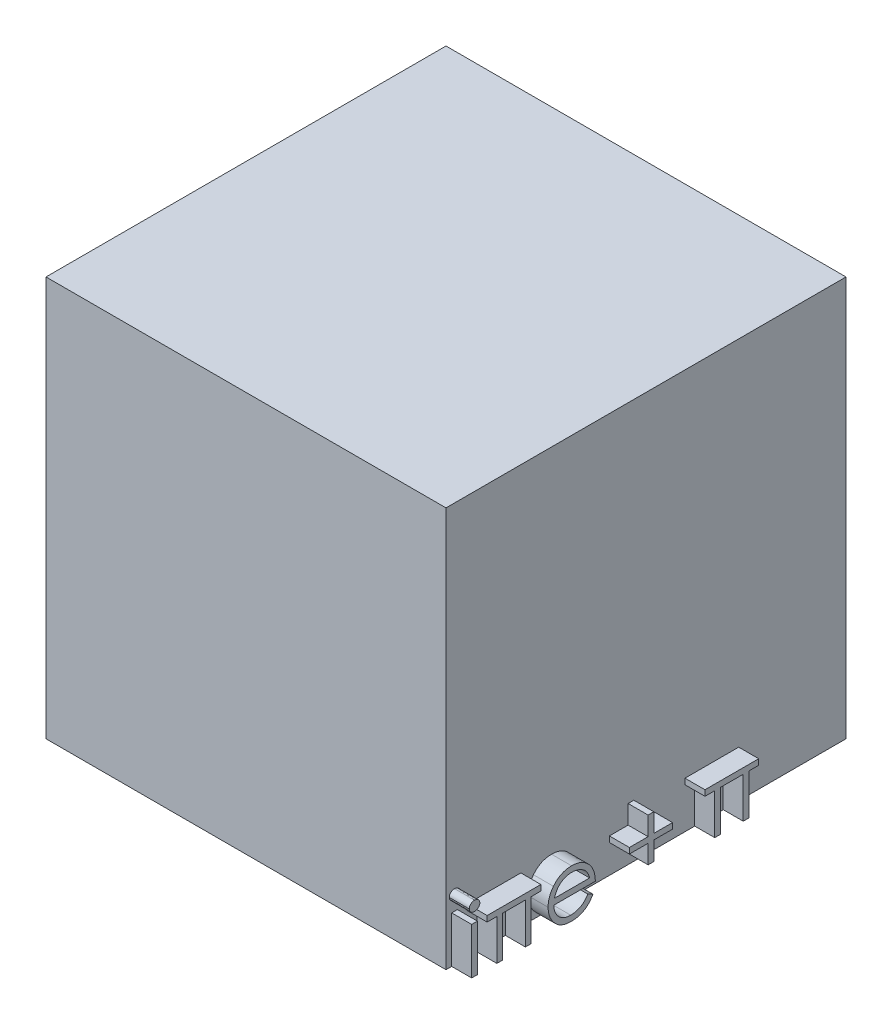
from build123d import *

# Parameters (mm, degrees)
SKETCH2_W           = 20
SKETCH2_H           = 20
BOSS_EXTRUDE1_DEPTH = 20
SKETCH3_W           = 0.284935898
SKETCH3_H           = 2.320192308
BOSS_EXTRUDE2_DEPTH = 1


with BuildPart() as part:
    # Sketch2 → Boss-Extrude1 (new body)
    with BuildSketch(Plane(origin=(0, 0, 0), x_dir=(1, 0, 0), z_dir=(0, 1, 0))):
        with Locations((10, -10)):
            Rectangle(SKETCH2_W, SKETCH2_H)
    extrude(amount=BOSS_EXTRUDE1_DEPTH)

    # Sketch3 → Boss-Extrude2 (add)
    # profile 1 of 6: a face of its own
    with BuildSketch(Plane(origin=(20, 0, 0), x_dir=(0, 0, -1), z_dir=(1, 0, 0))):
        with BuildLine():
            add(Edge.make_bspline(
                [(-19.573868189, 3.297115385), (-19.556186781, 3.296295189), (-19.521563189, 3.294689089), (-19.47149501, 3.280935463), (-19.425904721, 3.257622177), (-19.385466349, 3.226344181), (-19.350766423, 3.189560043), (-19.326472493, 3.146687593), (-19.310858391, 3.100370114), (-19.308972844, 3.06806214), (-19.308012821, 3.05161258)],
                knots=[0, 0, 0, 0, 1.055194115, 2.066272739, 3.074728998, 4.095836921, 5.109056067, 6.073838105, 7.019297344, 8, 8, 8, 8], degree=3))
            add(Edge.make_bspline(
                [(-19.308012821, 3.05161258), (-19.308994494, 3.03559003), (-19.310935147, 3.003915346), (-19.326460432, 2.958400839), (-19.350973462, 2.916124096), (-19.385444098, 2.879411381), (-19.425910617, 2.848150675), (-19.471493444, 2.824832805), (-19.521563601, 2.811080395), (-19.55618692, 2.809474127), (-19.573868189, 2.808653846)],
                knots=[0, 0, 0, 0, 0.96129708, 1.900370562, 2.859976407, 3.87933698, 4.906634145, 5.921202961, 6.938410037, 8, 8, 8, 8], degree=3))
            add(Edge.make_bspline(
                [(-19.573868189, 2.808653846), (-19.591347267, 2.809442807), (-19.625368009, 2.810978415), (-19.674686502, 2.825102646), (-19.71988806, 2.848158655), (-19.760405299, 2.879206694), (-19.794178403, 2.916349565), (-19.818760455, 2.958375039), (-19.834249885, 3.003921915), (-19.836195369, 3.035592237), (-19.837179487, 3.05161258)],
                knots=[0, 0, 0, 0, 1.054934014, 2.053291228, 3.073705704, 4.106921865, 5.123545215, 6.088680038, 7.033164197, 8, 8, 8, 8], degree=3))
            add(Edge.make_bspline(
                [(-19.837179487, 3.05161258), (-19.83621693, 3.068059851), (-19.834326407, 3.100363328), (-19.818748845, 3.146713822), (-19.794383162, 3.189332756), (-19.760382936, 3.226548745), (-19.719894012, 3.257614247), (-19.674684964, 3.280665637), (-19.625368416, 3.294791066), (-19.591347405, 3.296326509), (-19.573868189, 3.297115385)],
                knots=[0, 0, 0, 0, 0.98631895, 1.937192651, 2.907499808, 3.917963147, 4.944918757, 5.95915025, 6.951458133, 8, 8, 8, 8], degree=3))
        make_face()
    # profile 2 of 6: a face of its own
    with BuildSketch(Plane(origin=(20, 0, 0), x_dir=(0, 0, -1), z_dir=(1, 0, 0))):
        with Locations((-19.572596154, 1.160096154)):
            Rectangle(SKETCH3_W, SKETCH3_H)
    # profile 3 of 6: a face of its own
    with BuildSketch(Plane(origin=(20, 0, 0), x_dir=(0, 0, -1), z_dir=(1, 0, 0))):
        Polygon((-16.256585145, 2.03525641), (-16.745046683, 2.03525641), (-16.745046683, 0), (-17.029982581, 0), (-17.029982581, 2.03525641), (-18.169726171, 2.03525641), (-18.169726171, 0), (-18.454662068, 0), (-18.454662068, 2.03525641), (-18.943123606, 2.03525641), (-18.943123606, 2.320192308), (-16.256585145, 2.320192308), align=None)
    # profile 4 of 6: a face of its own
    with BuildSketch(Plane(origin=(20, 0, 0), x_dir=(0, 0, -1), z_dir=(1, 0, 0))):
        with BuildLine():
            Line((-13.909152811, 0.732692308), (-13.656017795, 0.599764623))
            add(Edge.make_bspline(
                [(-13.656017795, 0.599764623), (-13.676189563, 0.563983887), (-13.715435837, 0.494368744), (-13.782927944, 0.398726985), (-13.853677895, 0.312686557), (-13.930879352, 0.238546085), (-14.012222561, 0.1739109), (-14.098158612, 0.117361587), (-14.189134897, 0.069175501), (-14.285155718, 0.028578565), (-14.387027454, -0.002635762), (-14.494996972, -0.024683162), (-14.609271115, -0.038311413), (-14.687599435, -0.039894505), (-14.727707498, -0.040705128)],
                knots=[0, 0, 0, 0, 1.120438281, 2.179929193, 3.190490725, 4.156257408, 5.095198341, 6.022838206, 6.959905092, 7.901321166, 8.864066838, 9.862729781, 10.905609505, 12, 12, 12, 12], degree=3))
            add(Edge.make_bspline(
                [(-14.727707498, -0.040705128), (-14.772286292, -0.039664476), (-14.859246605, -0.037634466), (-14.985829089, -0.020133445), (-15.10500899, 0.008416481), (-15.216779607, 0.048299508), (-15.320867222, 0.100394295), (-15.417478712, 0.163857539), (-15.507122139, 0.238363227), (-15.586972671, 0.324556715), (-15.658858193, 0.416796776), (-15.722290902, 0.5129139), (-15.775320143, 0.612666254), (-15.818457153, 0.7154188), (-15.853295852, 0.820523904), (-15.877577076, 0.928937878), (-15.891574062, 1.040367301), (-15.893718952, 1.115748455), (-15.894799846, 1.153735978)],
                knots=[0, 0, 0, 0, 1.145258523, 2.234067595, 3.276747158, 4.290159414, 5.277019952, 6.260822364, 7.254936242, 8.264827045, 9.274100331, 10.257902744, 11.220704747, 12.172965371, 13.118907548, 14.062713208, 15.023725156, 16, 16, 16, 16], degree=3))
            add(Edge.make_bspline(
                [(-15.894799846, 1.153735978), (-15.893839054, 1.189382002), (-15.89193489, 1.260027716), (-15.879932675, 1.364590031), (-15.858661724, 1.466215842), (-15.829473201, 1.564989591), (-15.791780285, 1.660745898), (-15.745668201, 1.753543042), (-15.691065115, 1.843282276), (-15.648907761, 1.899890833), (-15.627672442, 1.928405449)],
                knots=[0, 0, 0, 0, 1.024358464, 2.0301432, 3.019427413, 4.004406732, 4.986367066, 5.972626655, 6.978780325, 8, 8, 8, 8], degree=3))
            add(Edge.make_bspline(
                [(-15.627672442, 1.928405449), (-15.598909044, 1.962757924), (-15.5422934, 2.030374674), (-15.446538706, 2.119218727), (-15.342852099, 2.193644152), (-15.232532981, 2.25533634), (-15.11429918, 2.302211719), (-14.989740037, 2.337143598), (-14.857437256, 2.356717936), (-14.766990377, 2.359482757), (-14.720711304, 2.360897436)],
                knots=[0, 0, 0, 0, 1.030682036, 2.02871468, 2.997146059, 3.962720338, 4.930598197, 5.918074684, 6.934738563, 8, 8, 8, 8], degree=3))
            add(Edge.make_bspline(
                [(-14.720711304, 2.360897436), (-14.673133834, 2.35966912), (-14.579797682, 2.357259445), (-14.443697115, 2.334919842), (-14.314918465, 2.299493596), (-14.193513265, 2.249461229), (-14.079469206, 2.18490935), (-13.973527575, 2.104952108), (-13.87387656, 2.012044272), (-13.815902349, 1.940594789), (-13.786401409, 1.904236779)],
                knots=[0, 0, 0, 0, 1.056321875, 2.072262726, 3.055038591, 4.01806755, 4.982017516, 5.957941055, 6.960871419, 8, 8, 8, 8], degree=3))
            add(Edge.make_bspline(
                [(-13.786401409, 1.904236779), (-13.766329115, 1.876837816), (-13.726318134, 1.822222265), (-13.676201121, 1.733167001), (-13.632696913, 1.639993819), (-13.597923441, 1.541196621), (-13.56976618, 1.437946002), (-13.549394637, 1.329503836), (-13.537447911, 1.215902417), (-13.535099593, 1.138499042), (-13.53390241, 1.099038462)],
                knots=[0, 0, 0, 0, 0.94817472, 1.890038105, 2.849395472, 3.817997239, 4.812318967, 5.836947057, 6.897266129, 8, 8, 8, 8], degree=3))
            Line((-13.53390241, 1.099038462), (-15.609863949, 1.099038462))
            add(Edge.make_bspline(
                [(-15.609863949, 1.099038462), (-15.608467306, 1.068467326), (-15.605720864, 1.008350421), (-15.592916412, 0.920384068), (-15.572733596, 0.836588251), (-15.544368089, 0.757591491), (-15.510017451, 0.682362018), (-15.467938979, 0.611457885), (-15.417738098, 0.545202048), (-15.361744071, 0.483001859), (-15.29941692, 0.427611026), (-15.233846142, 0.378034057), (-15.164092694, 0.336481837), (-15.090706576, 0.302754366), (-15.013806456, 0.276350779), (-14.933368108, 0.258327828), (-14.849549816, 0.246256381), (-14.792412758, 0.244914113), (-14.763324485, 0.244230769)],
                knots=[0, 0, 0, 0, 1.094153842, 2.151609401, 3.174256925, 4.172055639, 5.149267565, 6.128595816, 7.11444997, 8.118368179, 9.117203808, 10.09244225, 11.054858984, 12.015122123, 12.976791628, 13.957293641, 14.960065497, 16, 16, 16, 16], degree=3))
            add(Edge.make_bspline(
                [(-14.763324485, 0.244230769), (-14.734884516, 0.244782363), (-14.678454161, 0.245876832), (-14.594415669, 0.256519351), (-14.511739097, 0.273728102), (-14.430766634, 0.297214021), (-14.353141652, 0.325858737), (-14.281254617, 0.360423472), (-14.21514185, 0.398659314), (-14.153350031, 0.442392376), (-14.093414201, 0.495921231), (-14.033957803, 0.56271935), (-13.970206839, 0.641720179), (-13.930301994, 0.701179461), (-13.909152811, 0.732692308)],
                knots=[0, 0, 0, 0, 0.99110716, 1.966546729, 2.947904876, 3.932708344, 4.903319531, 5.828989031, 6.710028674, 7.56322171, 8.463672341, 9.504779593, 10.677557249, 12, 12, 12, 12], degree=3))
        make_face()
        with BuildLine():
            add(Edge.make_bspline(
                [(-13.818838308, 1.383974359), (-13.829267388, 1.421768537), (-13.849340012, 1.494510165), (-13.891283, 1.595240115), (-13.938519326, 1.68476414), (-13.994419039, 1.762397092), (-14.057754598, 1.831343136), (-14.130911299, 1.891594282), (-14.212949574, 1.945494398), (-14.303445366, 1.990989879), (-14.399277556, 2.02971568), (-14.499613173, 2.055682749), (-14.60199131, 2.073471405), (-14.671237412, 2.075127947), (-14.706082899, 2.075961538)],
                knots=[0, 0, 0, 0, 1.154881502, 2.222775134, 3.210006277, 4.132804581, 5.035138423, 5.962687519, 6.919655026, 7.923214229, 8.944639381, 9.960483929, 10.97369054, 12, 12, 12, 12], degree=3))
            add(Edge.make_bspline(
                [(-14.706082899, 2.075961538), (-14.734521318, 2.075406665), (-14.790738094, 2.074309797), (-14.873561206, 2.063904751), (-14.953099219, 2.046705463), (-15.029939015, 2.023151538), (-15.10307366, 1.991756592), (-15.174007485, 1.954941807), (-15.240936845, 1.910000514), (-15.282793592, 1.875747838), (-15.303939469, 1.85844351)],
                knots=[0, 0, 0, 0, 1.04873581, 2.073130211, 3.073294108, 4.04793562, 5.032784715, 6.005352987, 6.992311501, 8, 8, 8, 8], degree=3))
            add(Edge.make_bspline(
                [(-15.303939469, 1.85844351), (-15.319082661, 1.844750809), (-15.34972879, 1.81704012), (-15.390677691, 1.769297911), (-15.429884835, 1.717816137), (-15.465566077, 1.660625203), (-15.498293602, 1.598376353), (-15.528918724, 1.531594641), (-15.55648354, 1.459773302), (-15.571992154, 1.409724017), (-15.57997112, 1.383974359)],
                knots=[0, 0, 0, 0, 0.879870761, 1.780643979, 2.707998968, 3.669668524, 4.684282772, 5.740141944, 6.837334558, 8, 8, 8, 8], degree=3))
            Line((-15.57997112, 1.383974359), (-13.818838308, 1.383974359))
        make_face(mode=Mode.SUBTRACT)
    # profile 5 of 6: a face of its own
    with BuildSketch(Plane(origin=(20, 0, 0), x_dir=(0, 0, -1), z_dir=(1, 0, 0))):
        Polygon((-10.894403598, 1.709615385), (-10.894403598, 2.645833333), (-10.6094677, 2.645833333), (-10.6094677, 1.709615385), (-9.673249751, 1.709615385), (-9.673249751, 1.424679487), (-10.6094677, 1.424679487), (-10.6094677, 0.488461538), (-10.894403598, 0.488461538), (-10.894403598, 1.424679487), (-11.830621546, 1.424679487), (-11.830621546, 1.709615385), align=None)
    # profile 6 of 6: a face of its own
    with BuildSketch(Plane(origin=(20, 0, 0), x_dir=(0, 0, -1), z_dir=(1, 0, 0))):
        Polygon((-5.364587302, 2.03525641), (-5.85304884, 2.03525641), (-5.85304884, 0), (-6.137984738, 0), (-6.137984738, 2.03525641), (-7.277728327, 2.03525641), (-7.277728327, 0), (-7.562664225, 0), (-7.562664225, 2.03525641), (-8.051125763, 2.03525641), (-8.051125763, 2.320192308), (-5.364587302, 2.320192308), align=None)
    extrude(amount=BOSS_EXTRUDE2_DEPTH)


solid = part.part
